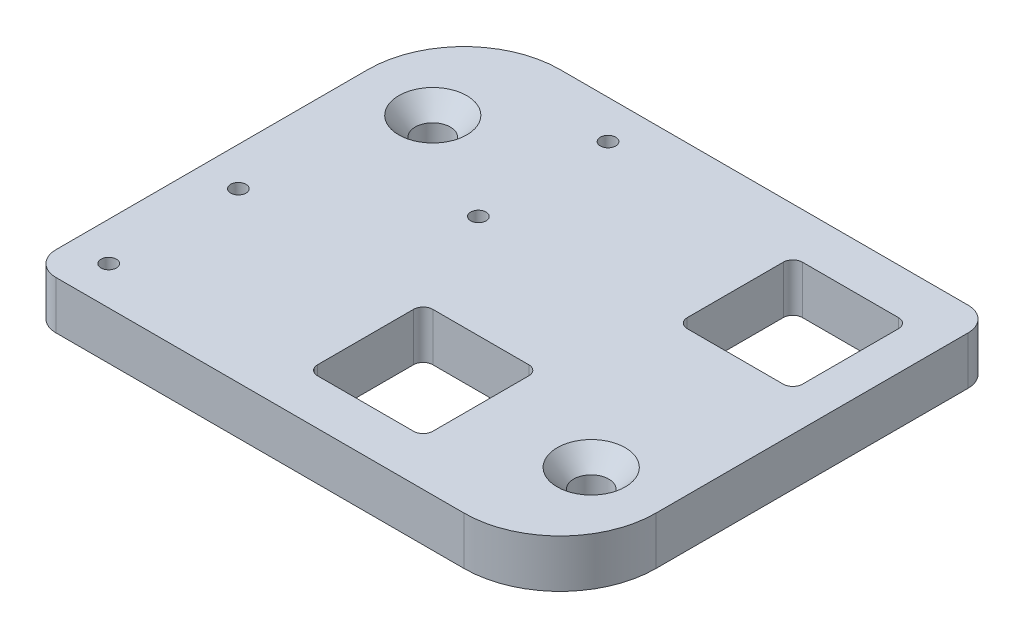
from build123d import *

# Parameters (mm, degrees)
BASE_SKETCH_W              = 55
BASE_SKETCH_H              = 45
BASE_EXTRUDE_DEPTH         = 5
MOSFET_MOUNTING_HOLES_D    = 1.6
MOUNTING_HOLES_D           = 3.6576
MOUNTING_HOLES_CSINK_D     = 7.0866
MOUNTING_HOLES_CSINK_ANGLE = 82
PIN_RELIEF_SKETCH_W        = 12
PIN_RELIEF_SKETCH_H        = 12
CUT_EXTRUDE1_DEPTH         = 53.974050251
FILLET1_R                  = 10
FILLET2_R                  = 2.5
FILLET3_R                  = 1


with BuildPart() as part:
    # Base Sketch → Base Extrude (new body)
    with BuildSketch(Plane(origin=(0, 0, 0), x_dir=(1, 0, 0), z_dir=(0, 1, 0))):
        with Locations((0, 22.5)):
            Rectangle(BASE_SKETCH_W, BASE_SKETCH_H)
    extrude(amount=-BASE_EXTRUDE_DEPTH)

    # Mosfet Mounting Holes (through all)
    with Locations(Plane(origin=(0, 0, 0), x_dir=(1, 0, 0), z_dir=(0, 1, 0))):
        with Locations((-23.5, 4), (-23.5, 17.5), (-8.5, 27.5), (-8.5, 41)):
            Hole(MOSFET_MOUNTING_HOLES_D / 2)

    # Mounting Holes (through all)
    with Locations(Plane(origin=(0, 0, 0), x_dir=(1, 0, 0), z_dir=(0, 1, 0))):
        with Locations((-20, 34.25), (20, 10.75)):
            CounterSinkHole(MOUNTING_HOLES_D / 2, MOUNTING_HOLES_CSINK_D / 2, counter_sink_angle=MOUNTING_HOLES_CSINK_ANGLE)

    # Pin Relief Sketch → Cut-Extrude1 (cut, through all)
    with BuildSketch(Plane(origin=(0, 0, 0), x_dir=(1, 0, 0), z_dir=(0, 1, 0))):
        with Locations((2.5, 10.75)):
            Rectangle(PIN_RELIEF_SKETCH_W, PIN_RELIEF_SKETCH_H)
        with Locations((17.5, 34.25)):
            Rectangle(PIN_RELIEF_SKETCH_W, PIN_RELIEF_SKETCH_H)
    extrude(amount=-CUT_EXTRUDE1_DEPTH, mode=Mode.SUBTRACT)

    # Fillet1
    fillet1_edges = [part.edges().sort_by_distance(p)[0] for p in [
        (-27.5, -2.5, -45),
        (27.5, -2.5, 0),
    ]]
    fillet(fillet1_edges, radius=FILLET1_R)

    # Fillet2
    fillet2_edges = [part.edges().sort_by_distance(p)[0] for p in [
        (-27.5, -2.5, 0),
        (27.5, -2.5, -45),
    ]]
    fillet(fillet2_edges, radius=FILLET2_R)

    # Fillet3
    fillet3_edges = [part.edges().sort_by_distance(p)[0] for p in [
        (8.5, -2.5, -16.75),
        (-3.5, -2.5, -16.75),
        (-3.5, -2.5, -4.75),
        (8.5, -2.5, -4.75),
        (23.5, -2.5, -28.25),
        (11.5, -2.5, -28.25),
        (11.5, -2.5, -40.25),
        (23.5, -2.5, -40.25),
    ]]
    fillet(fillet3_edges, radius=FILLET3_R)


solid = part.part
